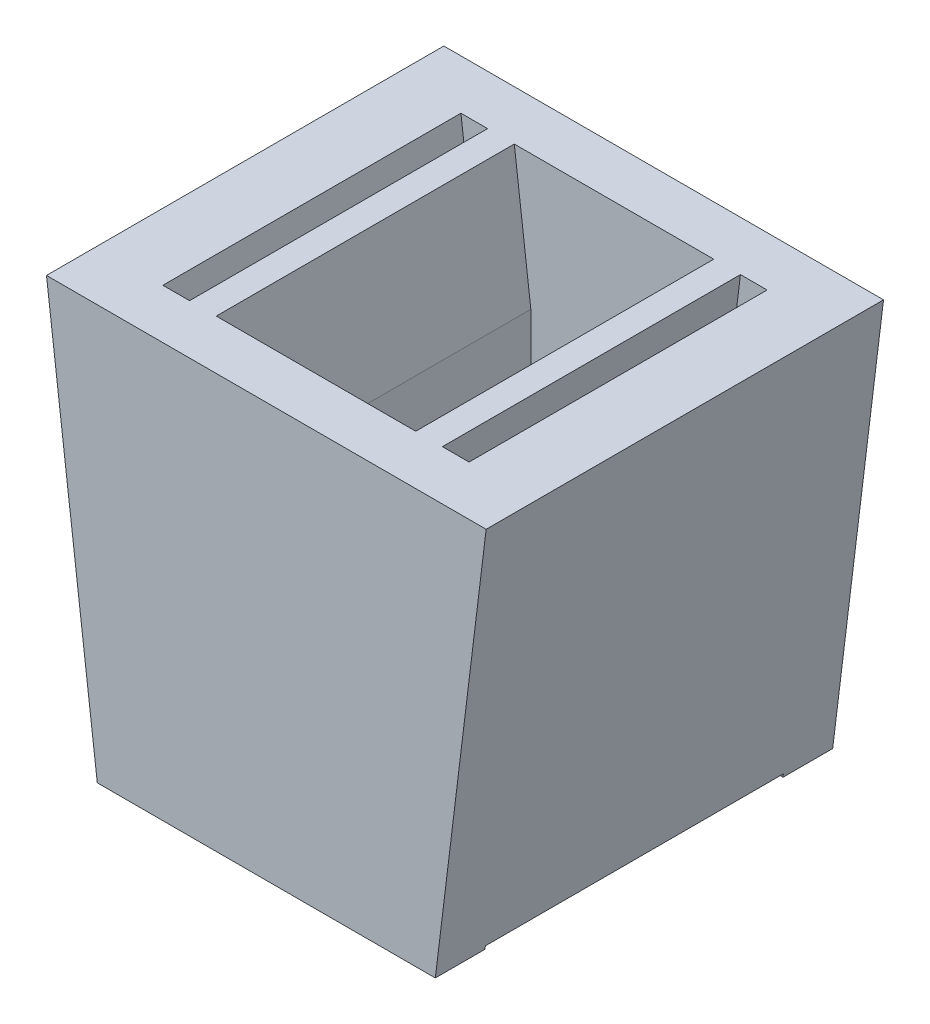
from build123d import *

# Parameters (mm, degrees)
SALIENTE_EXTRUIR1_DEPTH             = 30
SALIENTE_EXTRUIR1_2_DEPTH           = 30
SALIENTE_EXTRUIR1_3_DEPTH           = 30
SALIENTE_EXTRUIR1_4_DEPTH           = 30
SALIENTE_EXTRUIR3_REACH             = 48.233
CROQUIS3_W                          = 3.75
CROQUIS3_H                          = 31.257280714
SALIENTE_EXTRUIR3_DIRECTION_2_REACH = 48.233


with BuildPart() as part:
    # Croquis1 → Saliente-Extruir1 (new body)
    with BuildSketch(Plane.XY):
        Polygon((11.559312896, 31.017067239), (16.596862024, 31.017067239), (12.788445042, 0), (7.721401409, -0.240213475), align=None)
    extrude(amount=SALIENTE_EXTRUIR1_DEPTH)



with BuildPart() as body_2:
    # Croquis1 → Saliente-Extruir1 2 (new body)
    with BuildSketch(Plane.XY):
        Polygon((-7.529273594, 31.017067239), (-6.279253351, 20.836469336), (-6.279253351, 4.425451239), (-8.264345654, 20.592730649), (-9.544293245, 31.017067239), align=None)
    extrude(amount=SALIENTE_EXTRUIR1_2_DEPTH)


with BuildPart() as body_3:
    # Croquis1 → Saliente-Extruir1 3 (new body)
    with BuildSketch(Plane.XY):
        Polygon((-11.559312896, 31.017067239), (-7.721401409, -0.240213475), (-12.788445042, 0), (-16.596862024, 31.017067239), align=None)
    extrude(amount=SALIENTE_EXTRUIR1_3_DEPTH)


with BuildPart() as body_4:
    # Croquis1 → Saliente-Extruir1 4 (new body)
    with BuildSketch(Plane.XY):
        Polygon((7.529273594, 31.017067239), (6.279253351, 20.836469336), (6.279253351, 4.425451239), (8.264345654, 20.592730649), (9.544293245, 31.017067239), align=None)
    extrude(amount=SALIENTE_EXTRUIR1_4_DEPTH)


with BuildPart() as part_1:
    add(part.part)

    add(body_2.part)  # Saliente-Extruir3 merges body 2

    add(body_4.part)  # Saliente-Extruir3 merges body 4

    add(body_3.part)  # Saliente-Extruir3 merges body 3
    # Saliente-Extruir3: up to this plane
    saliente_extruir3_end = Plane(origin=(16.596862024, 31.017067239, 30), z_dir=(-0.992546151641322, 0.12186934340514874, 0))
    # Croquis3 → Saliente-Extruir3 (add, up to the surface)
    with BuildSketch(Plane(origin=(0, 0, 0), x_dir=(0, 0, -1), z_dir=(1, 0, 0)), mode=Mode.PRIVATE) as saliente_extruir3_sk1:
        with Locations((-28.125, 15.388426882)):
            Rectangle(CROQUIS3_W, CROQUIS3_H)
    saliente_extruir3_tool1 = split(extrude(saliente_extruir3_sk1.sketch, amount=SALIENTE_EXTRUIR3_REACH, mode=Mode.PRIVATE), bisect_by=saliente_extruir3_end, keep=Keep.BOTH, mode=Mode.PRIVATE)
    add(saliente_extruir3_tool1.solids().sort_by_distance((0, 15.388427, 28.125))[0])
    # Croquis3 → Saliente-Extruir3 (add, up to the surface)
    with BuildSketch(Plane(origin=(0, 0, 0), x_dir=(0, 0, -1), z_dir=(1, 0, 0)), mode=Mode.PRIVATE) as saliente_extruir3_sk2:
        with Locations((-1.875, 15.388426882)):
            Rectangle(CROQUIS3_W, CROQUIS3_H)
    saliente_extruir3_tool2 = split(extrude(saliente_extruir3_sk2.sketch, amount=SALIENTE_EXTRUIR3_REACH, mode=Mode.PRIVATE), bisect_by=saliente_extruir3_end, keep=Keep.BOTH, mode=Mode.PRIVATE)
    add(saliente_extruir3_tool2.solids().sort_by_distance((0, 15.388427, 1.875))[0])

    # Saliente-Extruir3 direction 2: up to this plane
    saliente_extruir3_direction_2_end = Plane(origin=(-16.596862024, 31.017067239, 30), z_dir=(0.992546151641322, 0.12186934340514874, 0))
    # Croquis3 → Saliente-Extruir3 direction 2 (add, up to the surface)
    with BuildSketch(Plane(origin=(0, 0, 0), x_dir=(0, 0, -1), z_dir=(1, 0, 0)), mode=Mode.PRIVATE) as saliente_extruir3_direction_2_sk1:
        with Locations((-28.125, 15.388426882)):
            Rectangle(CROQUIS3_W, CROQUIS3_H)
    saliente_extruir3_direction_2_tool1 = split(extrude(saliente_extruir3_direction_2_sk1.sketch, amount=-SALIENTE_EXTRUIR3_DIRECTION_2_REACH, mode=Mode.PRIVATE), bisect_by=saliente_extruir3_direction_2_end, keep=Keep.BOTH, mode=Mode.PRIVATE)
    add(saliente_extruir3_direction_2_tool1.solids().sort_by_distance((0, 15.388427, 28.125))[0])
    # Croquis3 → Saliente-Extruir3 direction 2 (add, up to the surface)
    with BuildSketch(Plane(origin=(0, 0, 0), x_dir=(0, 0, -1), z_dir=(1, 0, 0)), mode=Mode.PRIVATE) as saliente_extruir3_direction_2_sk2:
        with Locations((-1.875, 15.388426882)):
            Rectangle(CROQUIS3_W, CROQUIS3_H)
    saliente_extruir3_direction_2_tool2 = split(extrude(saliente_extruir3_direction_2_sk2.sketch, amount=-SALIENTE_EXTRUIR3_DIRECTION_2_REACH, mode=Mode.PRIVATE), bisect_by=saliente_extruir3_direction_2_end, keep=Keep.BOTH, mode=Mode.PRIVATE)
    add(saliente_extruir3_direction_2_tool2.solids().sort_by_distance((0, 15.388427, 1.875))[0])


solid = part_1.part
